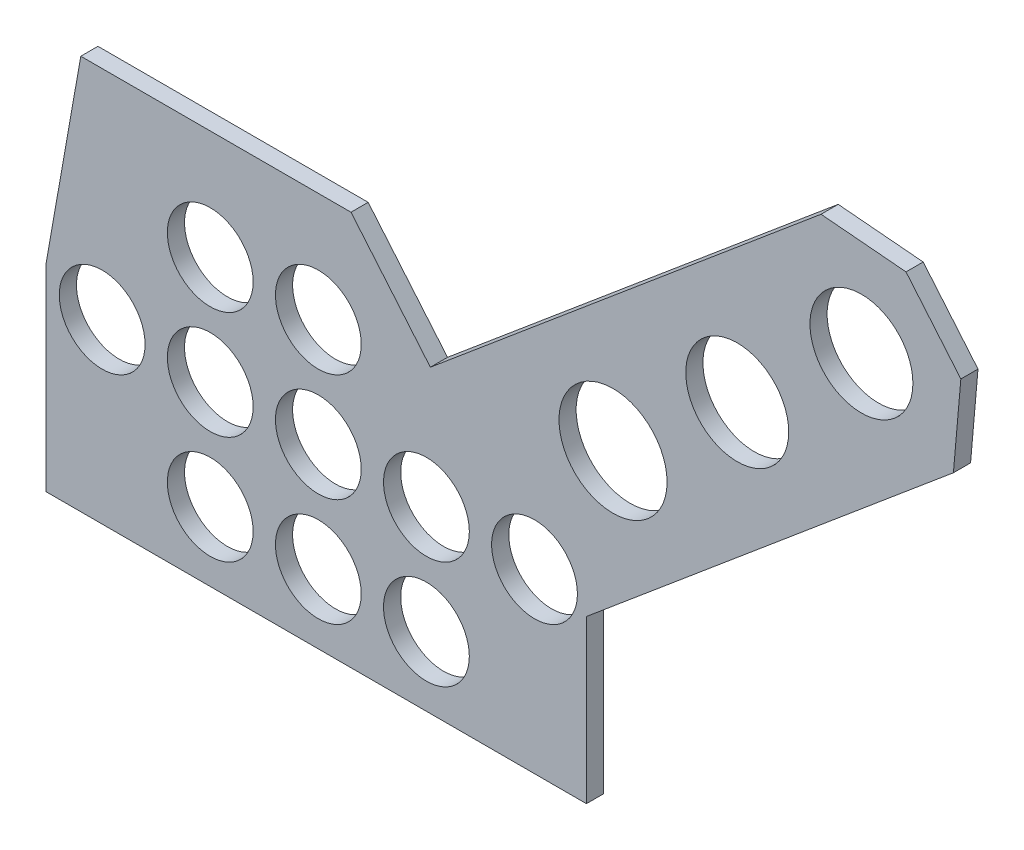
from build123d import *

# Parameters (mm, degrees)
BASE_EXTRUDE_DEPTH = 3.175
SKETCH3_R          = 9.525
SKETCH3_R_2        = 10
SKETCH3_R_3        = 7.9375
HOLES_DEPTH        = 206.325028591


with BuildPart() as part:
    # Sketch2 → Base Extrude (new body)
    with BuildSketch(Plane.XY):
        Polygon((0, 0), (100, 0), (100, 30), (167.901300028, 86.97595581), (169.276751583, 102.697439025), (159.132575314, 114.786797538), (143.411092099, 116.162249093), (71.118715891, 55.50174288), (56.435934796, 73), (6.435934796, 73), (0, 36.5), align=None)
    extrude(amount=BASE_EXTRUDE_DEPTH)

    # Sketch3 → Holes (cut, through all)
    with BuildSketch(Plane.XY.offset(3.175)):
        with Locations((150.882386677, 97.563400756)):
            Circle(SKETCH3_R)
        with Locations((127.901053383, 78.279772465)):
            Circle(SKETCH3_R)
        with Locations((104.91972009, 58.996144175)):
            Circle(SKETCH3_R_2)
        with Locations((30.39150811, 52.766671577)):
            Circle(SKETCH3_R_3)
        with Locations((50.39150811, 52.766671577)):
            Circle(SKETCH3_R_3)
        with Locations((10.39150811, 32.766671577)):
            Circle(SKETCH3_R_3)
        with Locations((30.39150811, 32.766671577)):
            Circle(SKETCH3_R_3)
        with Locations((50.39150811, 32.766671577)):
            Circle(SKETCH3_R_3)
        with Locations((70.39150811, 32.766671577)):
            Circle(SKETCH3_R_3)
        with Locations((30.39150811, 12.766671577)):
            Circle(SKETCH3_R_3)
        with Locations((50.39150811, 12.766671577)):
            Circle(SKETCH3_R_3)
        with Locations((70.39150811, 12.766671577)):
            Circle(SKETCH3_R_3)
        with Locations((90.39150811, 32.766671577)):
            Circle(SKETCH3_R_3)
    extrude(amount=-HOLES_DEPTH, mode=Mode.SUBTRACT)


solid = part.part
